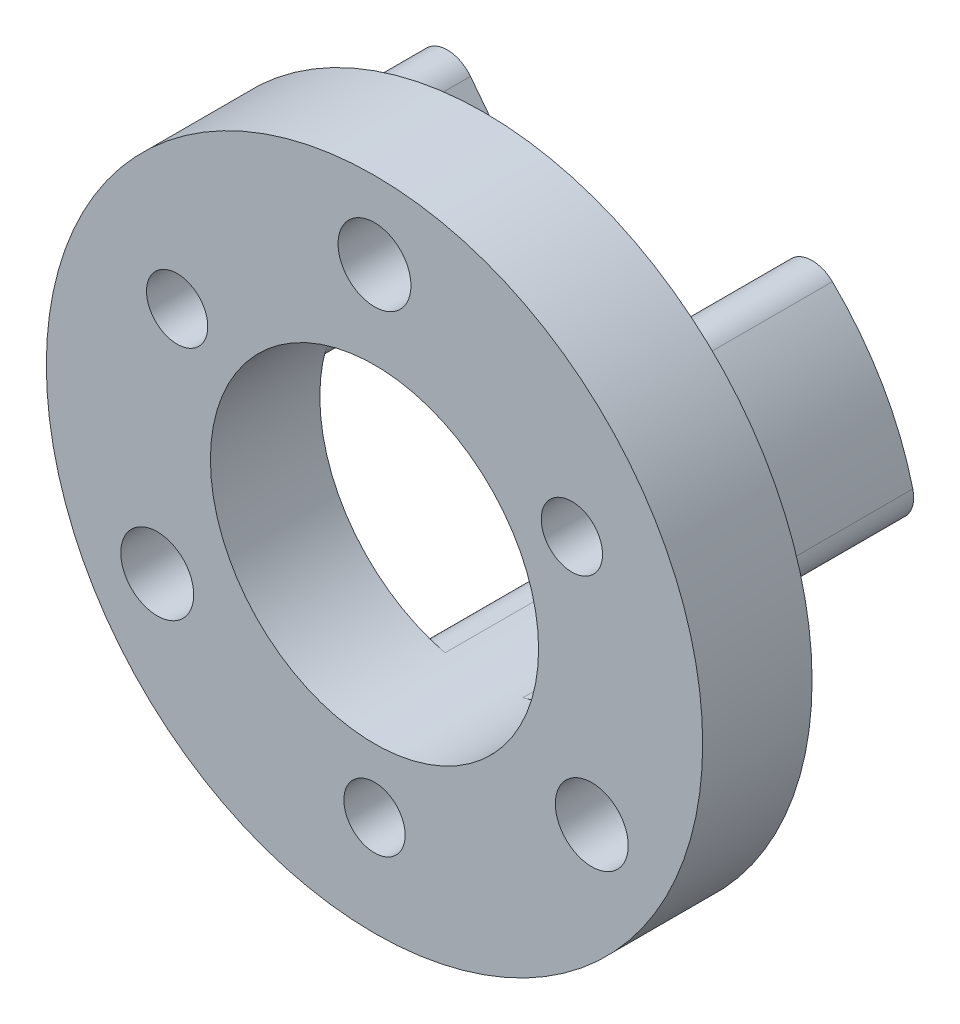
from build123d import *

# Parameters (mm, degrees)
BOSS_EXTRUDE1_DEPTH     = 10
FILLET1_R               = 2
BOSS_EXTRUDE2_START     = 10
SKETCH1_3_R             = 22.5
SKETCH1_3_R_2           = 20
SKETCH1_3_R_3           = 2.5
BOSS_EXTRUDE2_DEPTH     = 7.5
SKETCH2_R               = 2.1
CUT_EXTRUDE2_DEPTH      = 17.5
CIRPATTERN1_START       = 10
CIRPATTERN1_OUTLINE_R   = 2.1
CIRPATTERN1_DEPTH       = 7.5
CIRPATTERN1_2_OUTLINE_R = 2.1
CIRPATTERN1_2_DEPTH     = 10


# Read off the part's stored shape, not the designer's step: CirPattern1
with BuildPart() as part:
    # Sketch1 → Boss-Extrude1 (new body)
    with BuildSketch(Plane.XY):
        with BuildLine():
            ThreePointArc((6.867732558, 8.910485369), (9.742785793, 5.625), (11.150572969, 1.492388177))
            Line((11.150572969, 1.492388177), (19.823240833, 2.653134537))
            ThreePointArc((19.823240833, 2.653134537), (17.320508076, 10), (12.209302326, 15.840862878))
            Line((12.209302326, 15.840862878), (6.867732558, 8.910485369))
        make_face()
    extrude(amount=BOSS_EXTRUDE1_DEPTH)

    # Fillet1
    fillet1_edges = [part.edges().sort_by_distance(p)[0] for p in [
        (11.150572969, 1.492388177, 5),
        (6.867732558, 8.910485369, 5),
        (12.209302326, 15.840862878, 5),
        (19.823240833, 2.653134537, 5),
    ]]
    fillet(fillet1_edges, radius=FILLET1_R)

    # Sketch1<3> → Boss-Extrude2 (add)
    # profile 1 of 3: a face of its own
    with BuildSketch(Plane.XY.offset(BOSS_EXTRUDE2_START)):
        Circle(SKETCH1_3_R)
        Circle(SKETCH1_3_R_2, mode=Mode.SUBTRACT)
    # profile 2 of 3: a face of its own
    with BuildSketch(Plane.XY.offset(BOSS_EXTRUDE2_START)):
        with BuildLine():
            Line((19.823240833, 2.653134537), (11.150572969, 1.492388177))
            ThreePointArc((11.150572969, 1.492388177), (11.225115721, 0.747848281), (11.25, 0))
            ThreePointArc((11.25, 0), (-10.095159515, -4.964902251), (6.867732558, 8.910485369))
            Line((6.867732558, 8.910485369), (12.209302326, 15.840862878))
            ThreePointArc((12.209302326, 15.840862878), (-17.946950249, -8.82649289), (20, 0))
            ThreePointArc((20, 0), (19.955761282, 1.329508055), (19.823240833, 2.653134537))
        make_face()
        with Locations((-14.895636945, -8.6)):
            Circle(SKETCH1_3_R_3, mode=Mode.SUBTRACT)
        with Locations((14.895636945, -8.6)):
            Circle(SKETCH1_3_R_3, mode=Mode.SUBTRACT)
        with Locations((0, 17.2)):
            Circle(SKETCH1_3_R_3, mode=Mode.SUBTRACT)
    # profile 3 of 3: a face of its own
    with BuildSketch(Plane.XY.offset(BOSS_EXTRUDE2_START)):
        with BuildLine():
            ThreePointArc((6.867732558, 8.910485369), (9.742785793, 5.625), (11.150572969, 1.492388177))
            Line((11.150572969, 1.492388177), (19.823240833, 2.653134537))
            ThreePointArc((19.823240833, 2.653134537), (17.320508076, 10), (12.209302326, 15.840862878))
            Line((12.209302326, 15.840862878), (6.867732558, 8.910485369))
        make_face()
    extrude(amount=BOSS_EXTRUDE2_DEPTH)

    # Sketch2 → Cut-Extrude2 (cut)
    with BuildSketch(Plane(origin=(0, 0, 0), x_dir=(-1, 0, 0), z_dir=(0, 0, -1))):
        with Locations((-13.531646934, 7.8125)):
            Circle(SKETCH2_R)
    extrude(amount=-CUT_EXTRUDE2_DEPTH, mode=Mode.SUBTRACT)

    # CirPattern1 outline → CirPattern1 (cut)
    with BuildSketch(Plane.XY.offset(CIRPATTERN1_START)):
        with Locations((0, -15.625)):
            Circle(CIRPATTERN1_OUTLINE_R)
        with Locations((-13.531646934, 7.8125)):
            Circle(CIRPATTERN1_OUTLINE_R)
    extrude(amount=CIRPATTERN1_DEPTH, mode=Mode.SUBTRACT)

    # CirPattern1 2 outline → CirPattern1 2 (add)
    # profile 1 of 2: a face of its own
    with BuildSketch(Plane.XY):
        with BuildLine():
            ThreePointArc((-13.893798079, 14.386186949), (-17.320508076, 10), (-19.405702401, 4.839288617))
            ThreePointArc((-19.405702401, 4.839288617), (-19.119544932, 3.231563339), (-17.730445615, 2.373035672))
            Line((-17.730445615, 2.373035672), (-12.982425667, 1.737562602))
            ThreePointArc((-12.982425667, 1.737562602), (-11.626778767, 2.043231391), (-10.797548106, 3.158394355))
            ThreePointArc((-10.797548106, 3.158394355), (-9.742785793, 5.625), (-8.1340238, 7.771753781))
            ThreePointArc((-8.1340238, 7.771753781), (-7.582879674, 9.047470081), (-7.995986187, 10.37432913))
            Line((-7.995986187, 10.37432913), (-10.920331983, 14.168498487))
            ThreePointArc((-10.920331983, 14.168498487), (-12.358388411, 14.94222995), (-13.893798079, 14.386186949))
        make_face()
        with Locations((-13.531646934, 7.8125)):
            Circle(CIRPATTERN1_2_OUTLINE_R, mode=Mode.SUBTRACT)
    # profile 2 of 2: a face of its own
    with BuildSketch(Plane.XY):
        with BuildLine():
            ThreePointArc((2.663524306, -10.930148136), (0, -11.25), (-2.663524306, -10.930148136))
            ThreePointArc((-2.663524306, -10.930148136), (-4.043899093, -11.090701472), (-4.98643948, -12.111891731))
            Line((-4.98643948, -12.111891731), (-6.810113632, -16.541534159))
            ThreePointArc((-6.810113632, -16.541534159), (-6.761156521, -18.173793289), (-5.511904322, -19.225475566))
            ThreePointArc((-5.511904322, -19.225475566), (0, -20), (5.511904322, -19.225475566))
            ThreePointArc((5.511904322, -19.225475566), (6.761156521, -18.173793289), (6.810113632, -16.541534159))
            Line((6.810113632, -16.541534159), (4.98643948, -12.111891731))
            ThreePointArc((4.98643948, -12.111891731), (4.043899093, -11.090701472), (2.663524306, -10.930148136))
        make_face()
        with Locations((0, -15.625)):
            Circle(CIRPATTERN1_2_OUTLINE_R, mode=Mode.SUBTRACT)
    extrude(amount=CIRPATTERN1_2_DEPTH)


solid = part.part
